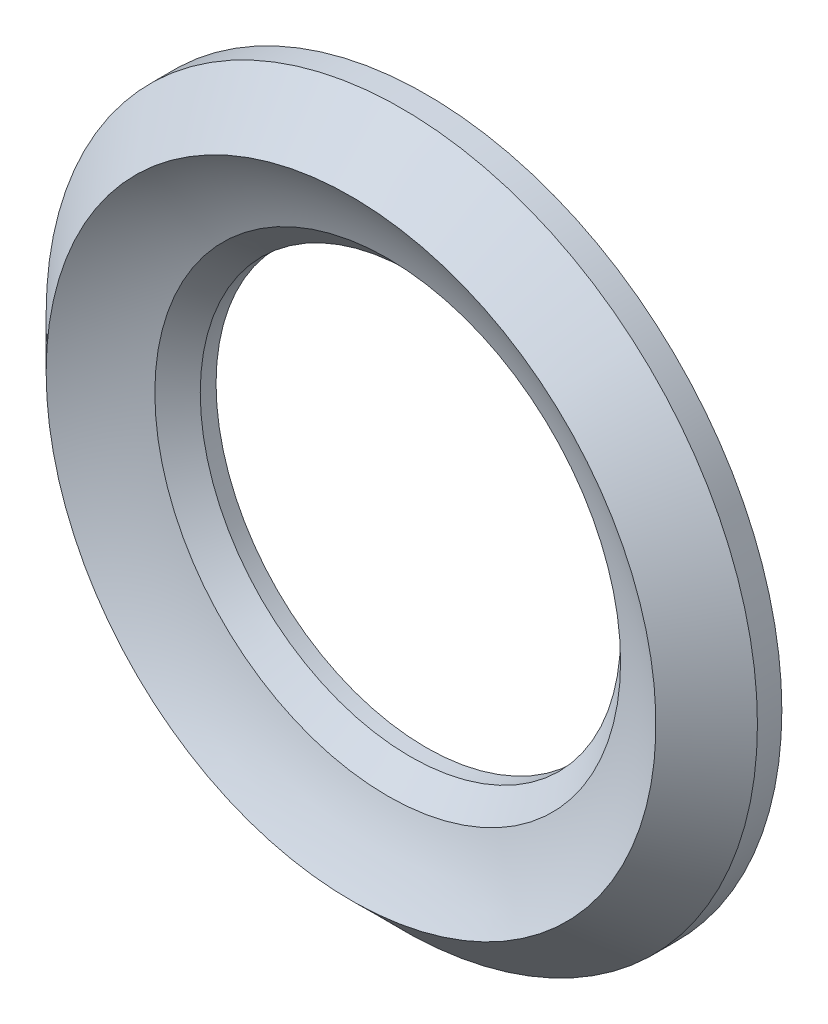
from build123d import *

# Parameters (mm, degrees)
FORMSENKUNG_F_R_M3_SENKSCHRAUBE_MIT_2_COUNT = 2
FORMSENKUNG_F_R_M3_SENKSCHRAUBE_MIT_2_PITCH = 24.748737342
FORMSENKUNG_F_R_M3_SENKSCHRAUBE_MIT_3_COUNT = 2
FORMSENKUNG_F_R_M3_SENKSCHRAUBE_MIT_3_PITCH = 13.393920133
FORMSENKUNG_F_R_M3_SENKSCHRAUBE_MIT_4_COUNT = 2
FORMSENKUNG_F_R_M3_SENKSCHRAUBE_MIT_4_PITCH = 13.393920133
FASE2_SIZE                                  = 1


with BuildPart() as part:
    # Skizze2 → Rotation1 (revolve)
    with BuildSketch(Plane(origin=(0, 0, 0), x_dir=(0, 0, -1), z_dir=(1, 0, 0)), mode=Mode.PRIVATE) as rotation1_sk:
        with BuildLine():
            Line((-4, 22), (-5.510050506, 22))
            Line((-5.510050506, 22), (-8.650908847, 18.859141659))
            ThreePointArc((-8.650908847, 18.859141659), (-7.034102467, 16.057337565), (-5.977288358, 13))
            Line((-5.977288358, 13), (-4, 13))
            Line((-4, 13), (-4, 22))
        make_face()
    revolve(rotation1_sk.sketch.rotate(Axis((0, 0, 0), (0, 0, 1)), 90), axis=Axis((0, 0, 0), (0, 0, 1)))

    # Skizze4 → Formsenkung für M3 Senkschraube mit Innensechskant1 (revolve, cut)
    with BuildSketch(Plane(origin=(-6.696960066, 16.167891819, -5.5), x_dir=(0, 1, 0), z_dir=(1, 0, 0))):
        Polygon((0, 0), (0, 12.480688495), (0.8, 12), (0.8, 1.15), (1.95, 0), align=None)
    formsenkung_f_r_m3_senkschraube_mit_inne = revolve(axis=Axis((-6.696960066, 16.167891819, -11.85), (0, 0, 1)), mode=Mode.SUBTRACT)

    # Formsenkung f_r M3 Senkschraube mit  2: Formsenkung für M3 Senkschraube mit Innensechskant1 ×2
    with Locations(*[Vector(0.9238795325112864, -0.3826834323650907, 0) * (i * FORMSENKUNG_F_R_M3_SENKSCHRAUBE_MIT_2_PITCH) for i in range(1, FORMSENKUNG_F_R_M3_SENKSCHRAUBE_MIT_2_COUNT)]):
        add(formsenkung_f_r_m3_senkschraube_mit_inne, mode=Mode.SUBTRACT)

    # Formsenkung f_r M3 Senkschraube mit  3: Formsenkung für M3 Senkschraube mit Innensechskant1 ×2
    with Locations(*[(i * FORMSENKUNG_F_R_M3_SENKSCHRAUBE_MIT_3_PITCH, 0, 0) for i in range(1, FORMSENKUNG_F_R_M3_SENKSCHRAUBE_MIT_3_COUNT)]):
        add(formsenkung_f_r_m3_senkschraube_mit_inne, mode=Mode.SUBTRACT)

    # Formsenkung f_r M3 Senkschraube mit  4: Formsenkung für M3 Senkschraube mit Innensechskant1 ×2
    with Locations(*[Vector(-0.7071067811865511, -0.707106781186544, 0) * (i * FORMSENKUNG_F_R_M3_SENKSCHRAUBE_MIT_4_PITCH) for i in range(1, FORMSENKUNG_F_R_M3_SENKSCHRAUBE_MIT_4_COUNT)]):
        add(formsenkung_f_r_m3_senkschraube_mit_inne, mode=Mode.SUBTRACT)

    # Spiegeln1: Formsenkung für M3 Senkschraube mit Innensechskant1 across plane
    add(formsenkung_f_r_m3_senkschraube_mit_inne.mirror(Plane.ZX), mode=Mode.SUBTRACT)

    # Spiegeln1 copy 1 sketch → Spiegeln1 copy 1 (revolve, cut)
    with BuildSketch(Plane(origin=(16.167891819, -6.696960066, -5.5), x_dir=(0, -1, 0), z_dir=(1, 0, 0))):
        Polygon((0, 0), (0, -12.480688495), (0.8, -12), (0.8, -1.15), (1.95, 0), align=None)
    revolve(axis=Axis((16.167891819, -6.696960066, -11.85), (0, 0, -1)), mode=Mode.SUBTRACT)

    # Spiegeln1 copy 2 sketch → Spiegeln1 copy 2 (revolve, cut)
    with BuildSketch(Plane(origin=(6.696960066, -16.167891819, -5.5), x_dir=(0, -1, 0), z_dir=(1, 0, 0))):
        Polygon((0, 0), (0, -12.480688495), (0.8, -12), (0.8, -1.15), (1.95, 0), align=None)
    revolve(axis=Axis((6.696960066, -16.167891819, -11.85), (0, 0, -1)), mode=Mode.SUBTRACT)

    # Spiegeln1 copy 3 sketch → Spiegeln1 copy 3 (revolve, cut)
    with BuildSketch(Plane(origin=(-16.167891819, -6.696960066, -5.5), x_dir=(0, -1, 0), z_dir=(1, 0, 0))):
        Polygon((0, 0), (0, -12.480688495), (0.8, -12), (0.8, -1.15), (1.95, 0), align=None)
    revolve(axis=Axis((-16.167891819, -6.696960066, -11.85), (0, 0, -1)), mode=Mode.SUBTRACT)

    # Fase2
    # the kernel refuses this chamfer: 1.357533455, 1 mm, written as the material it takes off along each edge
    with BuildSketch(Plane(origin=(0, 0, 5.977288358), x_dir=(-1, 0, 0), z_dir=(0, 1, 0))) as fase2_piece_1:
        with BuildLine():
            Line((13, -FASE2_SIZE), (14.404750469, 0.404750469))
            ThreePointArc((14.404750469, 0.404750469), (13.729596576, 0.193874689), (13, 0))
            Line((13, 0), (13, -FASE2_SIZE))
        make_face()
    revolve(axis=Axis((0, 0, 5.977288358), (0, 0, 1)), mode=Mode.SUBTRACT)


solid = part.part
